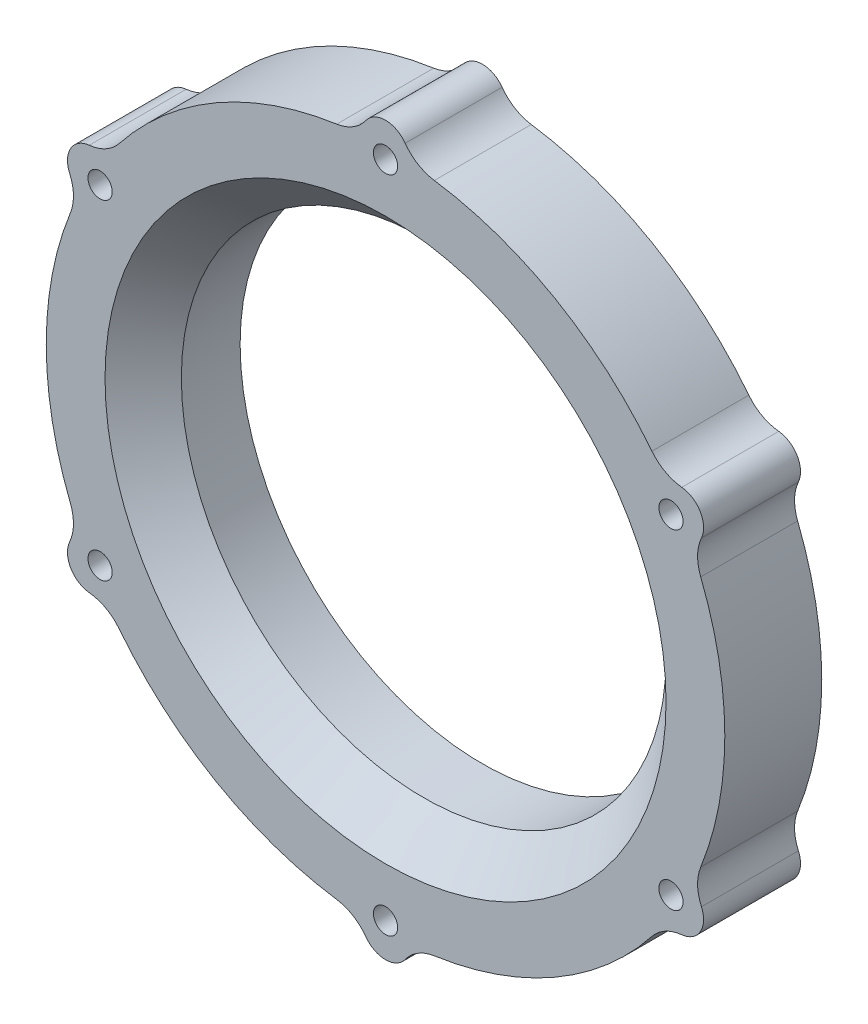
from build123d import *

# Parameters (mm, degrees)
SKETCH1_R           = 63.5
BOSS_EXTRUDE1_DEPTH = 25.4
CHAMFER1_SIZE       = 10
SKETCH3_R           = 3.175
CUT_EXTRUDE1_DEPTH  = 133.743860498
FILLET1_R           = 11.43


with BuildPart() as part:
    # Sketch1 → Boss-Extrude1 (new body)
    with BuildSketch(Plane.XY):
        with BuildLine():
            ThreePointArc((79.966230688, -38.84085413), (88.9, 0), (79.966230688, 38.84085413))
            ThreePointArc((79.966230688, 38.84085413), (82.48891971, 47.625), (73.620281725, 49.832360156))
            ThreePointArc((73.620281725, 49.832360156), (44.45, 76.989658396), (6.345948963, 88.673214286))
            ThreePointArc((6.345948963, 88.673214286), (0, 95.25), (-6.345948963, 88.673214286))
            ThreePointArc((-6.345948963, 88.673214286), (-44.45, 76.989658396), (-73.620281725, 49.832360156))
            ThreePointArc((-73.620281725, 49.832360156), (-82.48891971, 47.625), (-79.966230688, 38.84085413))
            ThreePointArc((-79.966230688, 38.84085413), (-88.9, 0), (-79.966230688, -38.84085413))
            ThreePointArc((-79.966230688, -38.84085413), (-82.48891971, -47.625), (-73.620281725, -49.832360156))
            ThreePointArc((-73.620281725, -49.832360156), (-44.45, -76.989658396), (-6.345948963, -88.673214286))
            ThreePointArc((-6.345948963, -88.673214286), (0, -95.25), (6.345948963, -88.673214286))
            ThreePointArc((6.345948963, -88.673214286), (44.45, -76.989658396), (73.620281725, -49.832360156))
            ThreePointArc((73.620281725, -49.832360156), (82.48891971, -47.625), (79.966230688, -38.84085413))
        make_face()
        Circle(SKETCH1_R, mode=Mode.SUBTRACT)
    extrude(amount=BOSS_EXTRUDE1_DEPTH)

    # Chamfer1
    chamfer1_edges = [part.edges().sort_by_distance(p)[0] for p in [
        (-63.5, 0, 25.4),
    ]]
    chamfer(chamfer1_edges, length=CHAMFER1_SIZE)

    # Sketch3 → Cut-Extrude1 (cut, through all)
    with BuildSketch(Plane.XY.offset(25.4)):
        with Locations((74.789953871, 43.18)):
            Circle(SKETCH3_R)
        with Locations((74.789953871, -43.18)):
            Circle(SKETCH3_R)
        with Locations((0, 86.36)):
            Circle(SKETCH3_R)
        with Locations((0, -86.36)):
            Circle(SKETCH3_R)
        with Locations((-74.789953871, 43.18)):
            Circle(SKETCH3_R)
        with Locations((-74.789953871, -43.18)):
            Circle(SKETCH3_R)
    extrude(amount=-CUT_EXTRUDE1_DEPTH, mode=Mode.SUBTRACT)

    # Fillet1
    fillet1_edges = [part.edges().sort_by_distance(p)[0] for p in [
        (73.620281725, 49.832360156, 12.7),
        (79.966230688, 38.84085413, 12.7),
        (79.966230688, -38.84085413, 12.7),
        (73.620281725, -49.832360156, 12.7),
        (6.345948963, -88.673214286, 12.7),
        (-6.345948963, -88.673214286, 12.7),
        (-73.620281725, -49.832360156, 12.7),
        (-79.966230688, -38.84085413, 12.7),
        (-79.966230688, 38.84085413, 12.7),
        (-73.620281725, 49.832360156, 12.7),
        (-6.345948963, 88.673214286, 12.7),
        (6.345948963, 88.673214286, 12.7),
    ]]
    fillet(fillet1_edges, radius=FILLET1_R)


solid = part.part
